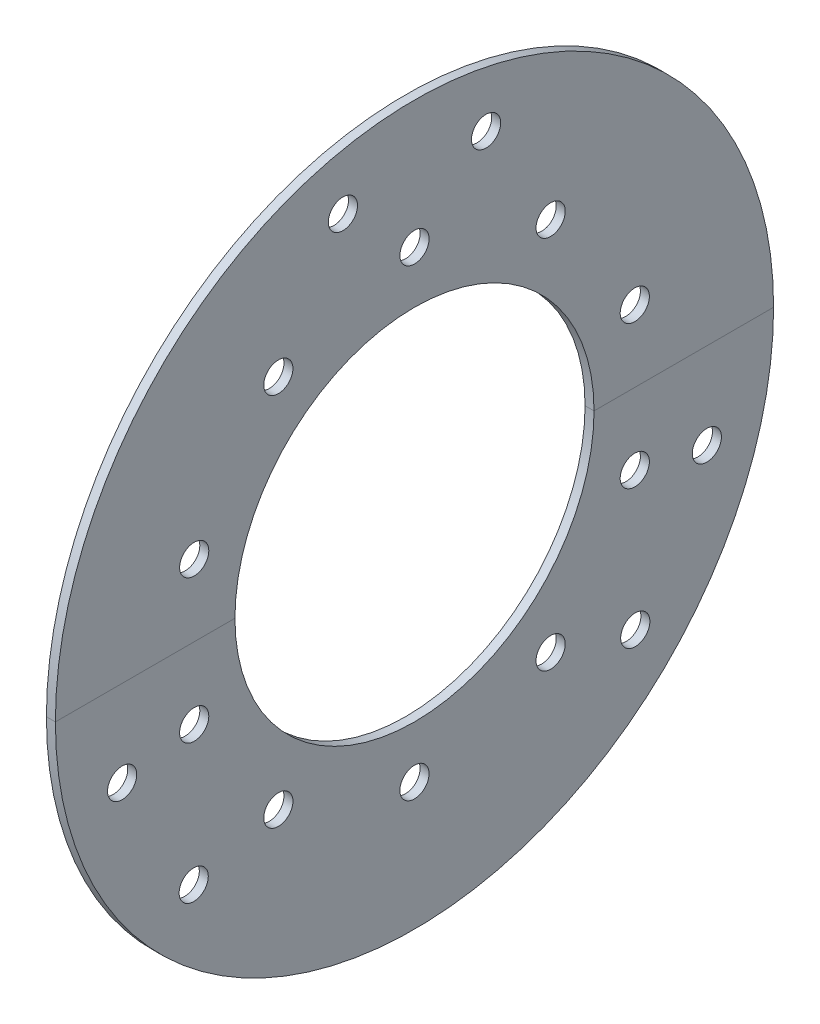
from build123d import *

# Parameters (mm, degrees)
SKETCH1_R           = 80
SKETCH1_R_2         = 40
SKETCH1_R_3         = 3.25
BOSS_EXTRUDE1_DEPTH = 2


with BuildPart() as part:
    # Sketch1 → Boss-Extrude1 (new body)
    with BuildSketch(Plane(origin=(0, 0, 0), x_dir=(0, 0, -1), z_dir=(1, 0, 0))):
        Circle(SKETCH1_R)
        Circle(SKETCH1_R_2, mode=Mode.SUBTRACT)
        with Locations((30.329719018, 41.74527691)):
            Circle(SKETCH1_R_3, mode=Mode.SUBTRACT)
        with Locations((49.074516241, 15.94527691)):
            Circle(SKETCH1_R_3, mode=Mode.SUBTRACT)
        with Locations((49.074516241, -15.94527691)):
            Circle(SKETCH1_R_3, mode=Mode.SUBTRACT)
        with Locations((30.329719018, -41.74527691)):
            Circle(SKETCH1_R_3, mode=Mode.SUBTRACT)
        with Locations((0, -51.6)):
            Circle(SKETCH1_R_3, mode=Mode.SUBTRACT)
        with Locations((-30.329719018, -41.74527691)):
            Circle(SKETCH1_R_3, mode=Mode.SUBTRACT)
        with Locations((-49.074516241, -15.94527691)):
            Circle(SKETCH1_R_3, mode=Mode.SUBTRACT)
        with Locations((-49.074516241, 15.94527691)):
            Circle(SKETCH1_R_3, mode=Mode.SUBTRACT)
        with Locations((-30.329719018, 41.74527691)):
            Circle(SKETCH1_R_3, mode=Mode.SUBTRACT)
        with Locations((0, 51.6)):
            Circle(SKETCH1_R_3, mode=Mode.SUBTRACT)
        with Locations((-15.94527691, 66)):
            Circle(SKETCH1_R_3, mode=Mode.SUBTRACT)
        with Locations((15.94527691, 66)):
            Circle(SKETCH1_R_3, mode=Mode.SUBTRACT)
        with Locations((65.130315105, -19.190985126)):
            Circle(SKETCH1_R_3, mode=Mode.SUBTRACT)
        with Locations((49.185038195, -46.809014874)):
            Circle(SKETCH1_R_3, mode=Mode.SUBTRACT)
        with Locations((-49.185038195, -46.809014874)):
            Circle(SKETCH1_R_3, mode=Mode.SUBTRACT)
        with Locations((-65.130315105, -19.190985126)):
            Circle(SKETCH1_R_3, mode=Mode.SUBTRACT)
    extrude(amount=BOSS_EXTRUDE1_DEPTH)


with BuildPart() as body_2:
    # Split1: the piece on the far side of the plane
    add(part.part)
    split(bisect_by=Plane.ZX, keep=Keep.BOTTOM)


with BuildPart() as part_1:
    add(part.part)

    # Split1
    split(bisect_by=Plane.ZX, keep=Keep.TOP)


solid = Compound([body_2.part, part_1.part])
